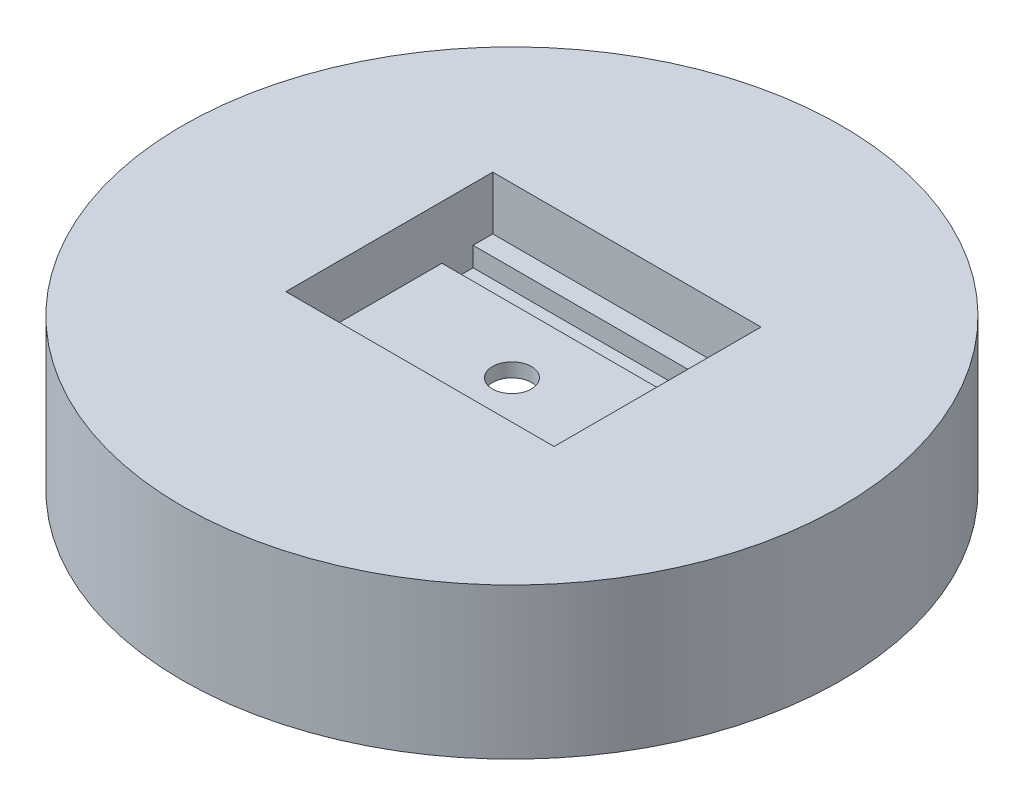
from build123d import *

# Parameters (mm, degrees)
SKETCH5_W          = 17.5
SKETCH5_H          = 13.5
CUT_EXTRUDE1_DEPTH = 6.35
SKETCH6_W          = 17.5
SKETCH6_H          = 2.032
CUT_EXTRUDE2_DEPTH = 10.16


with BuildPart() as part:
    # Sketch3 → Revolve1 (revolve)
    with BuildSketch(Plane.XY):
        Polygon((17.5, 0), (1.27, 5.442857143), (1.27, 9.839494163), (21.5, 9.839494163), (21.5, 0), align=None)
    revolve(axis=Axis((0, 0, 0), (0, -1, 0)))

    # Sketch5 → Cut-Extrude1 (cut)
    with BuildSketch(Plane(origin=(0, 12.7, 0), x_dir=(1, 0, 0), z_dir=(0, 1, 0))):
        with Locations((0, 0.75)):
            Rectangle(SKETCH5_W, SKETCH5_H)
    extrude(amount=-CUT_EXTRUDE1_DEPTH, mode=Mode.SUBTRACT)

    # Sketch6 → Cut-Extrude2 (cut)
    with BuildSketch(Plane(origin=(0, 15.24, 0), x_dir=(1, 0, 0), z_dir=(0, 1, 0))):
        with Locations((0, 5.2)):
            Rectangle(SKETCH6_W, SKETCH6_H)
    extrude(amount=-CUT_EXTRUDE2_DEPTH, mode=Mode.SUBTRACT)


solid = part.part
